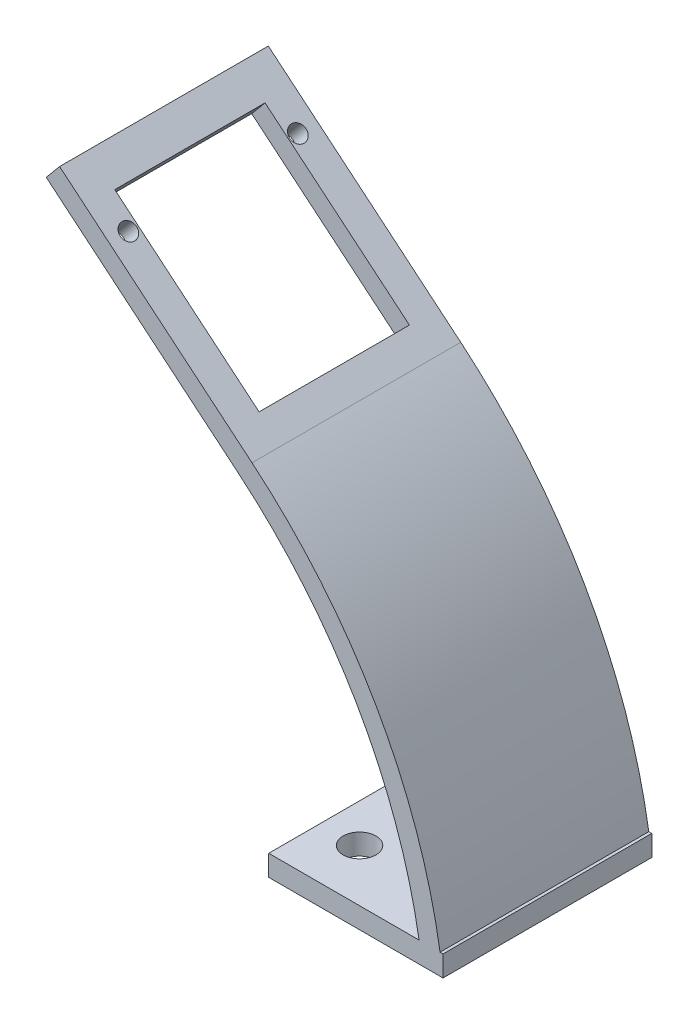
from build123d import *

# Parameters (mm, degrees)
BOSS_EXTRUDE1_DEPTH = 25.4
CUT_EXTRUDE1_REACH  = 81.149
SKETCH2_R           = 0.99949
SKETCH2_W           = 22.86
SKETCH2_H           = 18.288
SKETCH3_W           = 21.210427146
SKETCH3_H           = 25.4
SKETCH3_R           = 2
BOSS_EXTRUDE2_DEPTH = 2.54


with BuildPart() as part:
    # Sketch1 → Boss-Extrude1 (new body)
    with BuildSketch(Plane.XY):
        with BuildLine():
            Line((-22.332130244, 40.720807495), (-45.746440302, 60.234917377))
            Line((-45.746440302, 60.234917377), (-44.120264478, 62.186109882))
            Line((-44.120264478, 62.186109882), (-20.70595442, 42.672))
            ThreePointArc((-20.70595442, 42.672), (-5.010690915, 23.554414454), (2.54, 0))
            Line((2.54, 0), (0, 0))
            ThreePointArc((0, 0), (-7.309724658, 22.475300352), (-22.332130244, 40.720807495))
        make_face()
    extrude(amount=BOSS_EXTRUDE1_DEPTH)

    # Sketch2 → Cut-Extrude1 (cut, up to next)
    with BuildSketch(Plane(origin=(12.499484694, 14.997702276, 0), x_dir=(0.768186025531083, -0.6402267021756891, 0), z_dir=(0.6402267021756891, 0.768186025531083, 0)), mode=Mode.PRIVATE) as cut_extrude1_sk1:
        with Locations((-65.884565821, -2.416810605)):
            Circle(SKETCH2_R)
    cut_extrude1_tool1 = extrude(cut_extrude1_sk1.sketch, amount=-CUT_EXTRUDE1_REACH, mode=Mode.PRIVATE) & part.part
    # Sketch2 → Cut-Extrude1 (cut, up to next)
    with BuildSketch(Plane(origin=(12.499484694, 14.997702276, 0), x_dir=(0.768186025531083, -0.6402267021756891, 0), z_dir=(0.6402267021756891, 0.768186025531083, 0)), mode=Mode.PRIVATE) as cut_extrude1_sk2:
        with Locations((-65.889559314, -23.03399)):
            Circle(SKETCH2_R)
    cut_extrude1_tool2 = extrude(cut_extrude1_sk2.sketch, amount=-CUT_EXTRUDE1_REACH, mode=Mode.PRIVATE) & part.part
    # Sketch2 → Cut-Extrude1 (cut, up to next)
    with BuildSketch(Plane(origin=(12.499484694, 14.997702276, 0), x_dir=(0.768186025531083, -0.6402267021756891, 0), z_dir=(0.6402267021756891, 0.768186025531083, 0)), mode=Mode.PRIVATE) as cut_extrude1_sk3:
        with Locations((-58.160978666, -12.7)):
            Rectangle(SKETCH2_W, SKETCH2_H)
    cut_extrude1_tool3 = extrude(cut_extrude1_sk3.sketch, amount=-CUT_EXTRUDE1_REACH, mode=Mode.PRIVATE) & part.part
    add(cut_extrude1_tool1.solids().sort_by_distance((-38.112118, 57.178761, 2.416811))[0], mode=Mode.SUBTRACT)
    add(cut_extrude1_tool2.solids().sort_by_distance((-38.115954, 57.181958, 23.03399))[0], mode=Mode.SUBTRACT)
    add(cut_extrude1_tool3.solids().sort_by_distance((-32.178966, 52.233914, 12.7))[0], mode=Mode.SUBTRACT)

    # Sketch3 → Boss-Extrude2 (add)
    with BuildSketch(Plane(origin=(0, 0, 0), x_dir=(1, 0, 0), z_dir=(0, 1, 0))):
        with Locations((-8.065213573, -12.7)):
            Rectangle(SKETCH3_W, SKETCH3_H)
        with Locations((-13.97, -6.35)):
            Circle(SKETCH3_R, mode=Mode.SUBTRACT)
        with Locations((-13.97, -19.05)):
            Circle(SKETCH3_R, mode=Mode.SUBTRACT)
    extrude(amount=BOSS_EXTRUDE2_DEPTH)


solid = part.part
